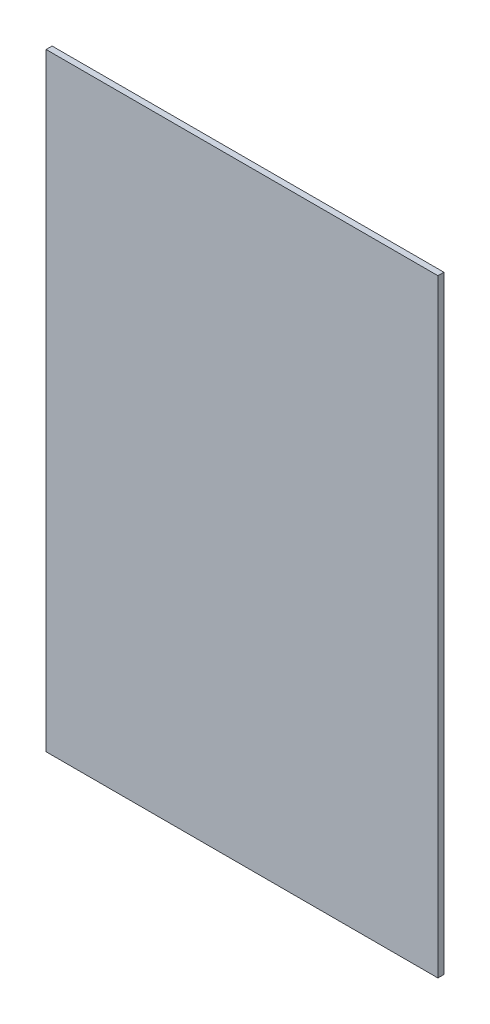
from build123d import *

# Parameters (mm, degrees)
SKETCH_1_W      = 652.3
SKETCH_1_H      = 1012.57
EXTRUDE_1_DEPTH = 10


with BuildPart() as part:
    # Эскиз1 → Бобышка-Вытянуть1 (new body)
    with BuildSketch(Plane.XY):
        with Locations((-836.15, 0)):
            Rectangle(SKETCH_1_W, SKETCH_1_H)
    extrude(amount=EXTRUDE_1_DEPTH)


solid = part.part
